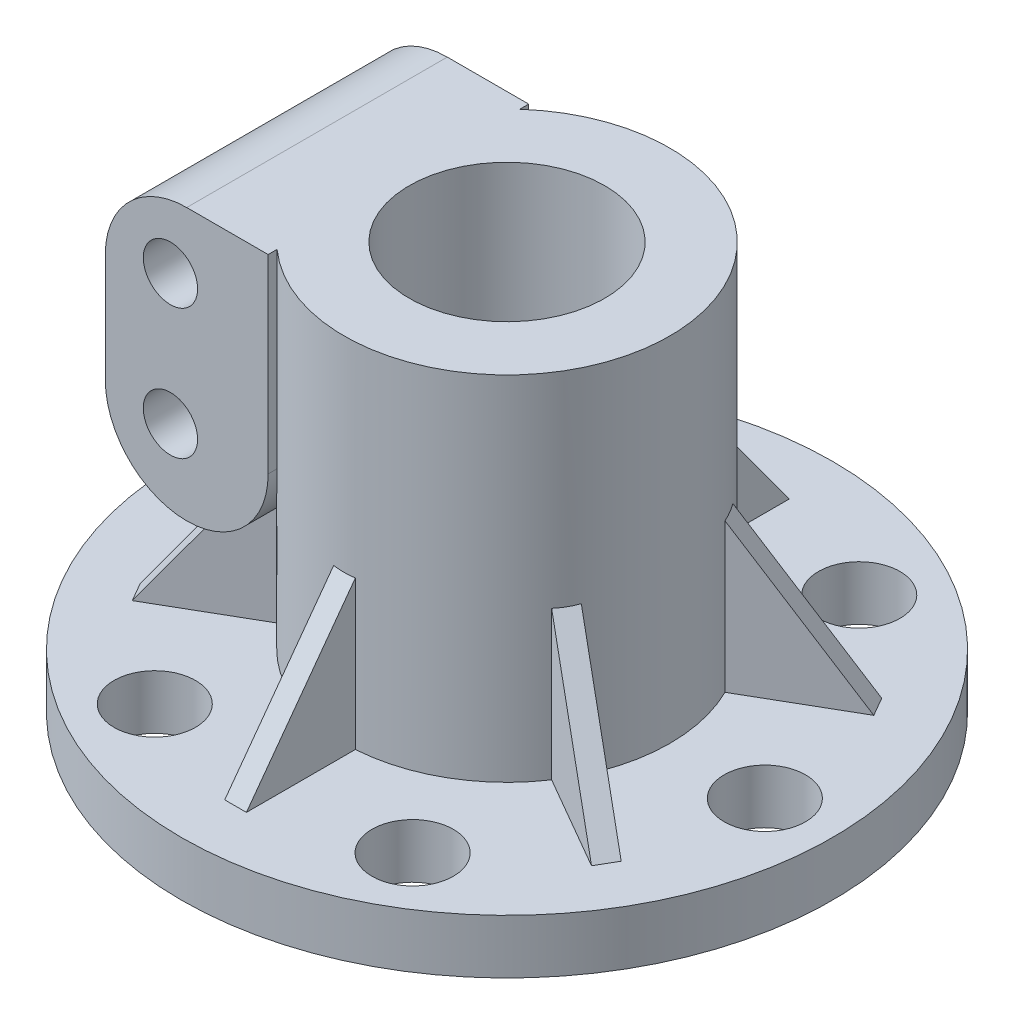
from build123d import *

# Parameters (mm, degrees)
BOSS_EXTRUDE1_DEPTH   = 48
HOLE1_D               = 10
BOSS_EXTRUDE2_DEPTH   = 2
CIRPATTERN1_COUNT     = 6
HOLE2_D               = 15
CIRPATTERN2_OUTLINE_R = 7.5
CIRPATTERN2_DEPTH     = 10


# Read off the part's stored shape, not the designer's step: CirPattern2
with BuildPart() as part:
    # Sketch1 → Revolve1 (revolve)
    with BuildSketch(Plane.XY, mode=Mode.PRIVATE) as revolve1_sk:
        Polygon((12, 0), (12, 10), (13, 10), (18, 20), (18, 75), (30, 75), (30, 10), (60, 10), (60, 0), align=None)
    revolve(revolve1_sk.sketch.rotate(Axis((0, 0, 0), (0, 1, 0)), 90), axis=Axis((0, 0, 0), (0, 1, 0)))

    # Sketch2 → Boss-Extrude1 (add)
    with BuildSketch(Plane.XY.offset(24)):
        with BuildLine():
            Line((-20, 60), (-20, 40))
            ThreePointArc((-20, 40), (-35, 25), (-50, 40))
            Line((-50, 40), (-50, 60))
            ThreePointArc((-50, 60), (-45.606601718, 70.606601718), (-35, 75))
            Line((-35, 75), (-20, 75))
            Line((-20, 75), (-20, 60))
        make_face()
    extrude(amount=-BOSS_EXTRUDE1_DEPTH)

    # Hole1 (through all)
    with Locations(Plane.XY.offset(24)):
        with Locations((-38, 63), (-38, 39)):
            Hole(HOLE1_D / 2)

    # Sketch5 → Boss-Extrude2 (add, symmetric)
    with BuildSketch(Plane(origin=(0, 0, 0), x_dir=(0, 0, -1), z_dir=(1, 0, 0))):
        Polygon((28, 40), (50, 10), (28, 10), align=None)
    boss_extrude2 = extrude(amount=BOSS_EXTRUDE2_DEPTH, both=True)

    # CirPattern1: Boss-Extrude2 ×6 about axis
    cirpattern1_axis = Axis((0, 0, 0), (0, 1, 0))
    for i in range(1, CIRPATTERN1_COUNT):
        add(boss_extrude2.rotate(cirpattern1_axis, i * 360 / CIRPATTERN1_COUNT))

    # Hole2 (through all)
    with Locations(Plane(origin=(0, 10, 0), x_dir=(1, 0, 0), z_dir=(0, 1, 0))):
        with Locations((47.5, 0)):
            Hole(HOLE2_D / 2)

    # CirPattern2 outline → CirPattern2 (cut)
    with BuildSketch(Plane(origin=(0, 0, 0), x_dir=(1, 0, 0), z_dir=(0, 1, 0))):
        with Locations((23.75, 41.13620668)):
            Circle(CIRPATTERN2_OUTLINE_R)
        with Locations((-23.75, 41.13620668)):
            Circle(CIRPATTERN2_OUTLINE_R)
        with Locations((-47.5, 0)):
            Circle(CIRPATTERN2_OUTLINE_R)
        with Locations((-23.75, -41.13620668)):
            Circle(CIRPATTERN2_OUTLINE_R)
        with Locations((23.75, -41.13620668)):
            Circle(CIRPATTERN2_OUTLINE_R)
    extrude(amount=CIRPATTERN2_DEPTH, mode=Mode.SUBTRACT)


solid = part.part
